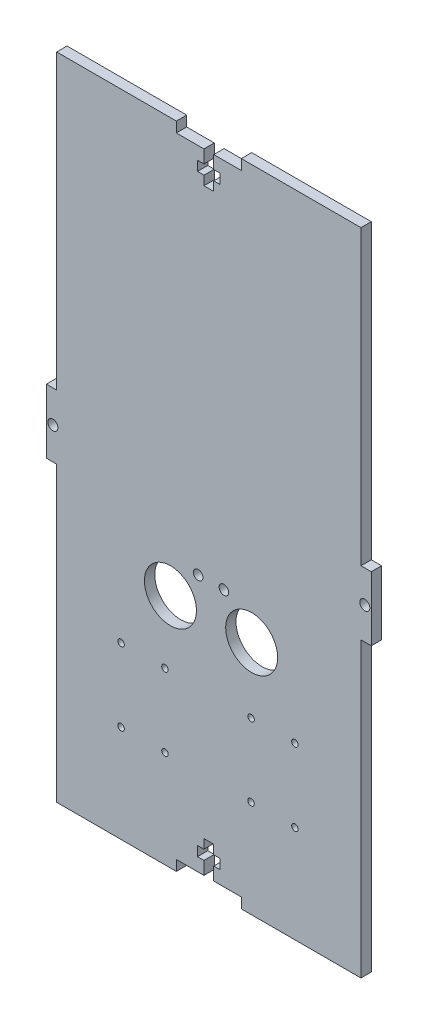
from build123d import *

# Parameters (mm, degrees)
SKETCH1_W           = 100
SKETCH1_H           = 200
BOSS_EXTRUDE2_DEPTH = 3.18
SKETCH2_R           = 1.55
SKETCH2_W           = 3.18
SKETCH2_H           = 90.125
CUT_EXTRUDE1_DEPTH  = 112.84861376
SKETCH4_R           = 1
CUT_EXTRUDE15_DEPTH = 10
SKETCH5_R           = 8
CUT_EXTRUDE16_DEPTH = 112.84861376
SKETCH6_R           = 1.47
CUT_EXTRUDE17_DEPTH = 112.84861376


with BuildPart() as part:
    # Sketch1 → Boss-Extrude2 (new body)
    with BuildSketch(Plane.XY):
        Rectangle(SKETCH1_W, SKETCH1_H)
    extrude(amount=BOSS_EXTRUDE2_DEPTH)

    # Sketch2 → Cut-Extrude1 (cut, through all)
    with BuildSketch(Plane.XY.offset(3.18)):
        with Locations((-48, 0)):
            Circle(SKETCH2_R)
        Polygon((-10, 100), (-10, 96.82), (-1.5, 96.82), (-1.5, 92.82), (-3.5, 92.82), (-3.5, 89.82), (-1.5, 89.82), (-1.5, 87), (1.5, 87), (1.5, 89.82), (3.5, 89.82), (3.5, 92.82), (1.5, 92.82), (1.5, 96.82), (10, 96.82), (10, 100), align=None)
        with Locations((-48.41, 54.9375)):
            Rectangle(SKETCH2_W, SKETCH2_H)
        with Locations((-48.41, -54.9375)):
            Rectangle(SKETCH2_W, SKETCH2_H)
    cut_extrude1 = extrude(amount=-CUT_EXTRUDE1_DEPTH, mode=Mode.SUBTRACT)

    # Mirror1: Cut-Extrude1 across plane
    add(cut_extrude1.mirror(Plane.ZX), mode=Mode.SUBTRACT)

    # Mirror3: Cut-Extrude1 across plane
    add(cut_extrude1.mirror(Plane(origin=(0, 0, 0), x_dir=(0, 0, 1), z_dir=(1, 0, 0))), mode=Mode.SUBTRACT)

    # Sketch4 → Cut-Extrude15 (cut)
    with BuildSketch(Plane(origin=(0, 0, 0), x_dir=(-1, 0, 0), z_dir=(0, 0, -1))):
        with Locations((13.504428345, -70.05)):
            Circle(SKETCH4_R)
        with Locations((27.004428345, -70.05)):
            Circle(SKETCH4_R)
        with Locations((27.004428345, -47.59)):
            Circle(SKETCH4_R)
        with Locations((13.504428345, -47.59)):
            Circle(SKETCH4_R)
        with Locations((-12.995571655, -47.59)):
            Circle(SKETCH4_R)
        with Locations((-26.495571655, -47.59)):
            Circle(SKETCH4_R)
        with Locations((-26.495571655, -70.05)):
            Circle(SKETCH4_R)
        with Locations((-12.995571655, -70.05)):
            Circle(SKETCH4_R)
    extrude(amount=-CUT_EXTRUDE15_DEPTH, mode=Mode.SUBTRACT)

    # Sketch5 → Cut-Extrude16 (cut, through all)
    with BuildSketch(Plane(origin=(0, 0, 0), x_dir=(-1, 0, 0), z_dir=(0, 0, -1))):
        with Locations((11.82, -27.421398987)):
            Circle(SKETCH5_R)
        with Locations((-13.18, -27.421398987)):
            Circle(SKETCH5_R)
    extrude(amount=-CUT_EXTRUDE16_DEPTH, mode=Mode.SUBTRACT)

    # Sketch6 → Cut-Extrude17 (cut, through all)
    with BuildSketch(Plane(origin=(0, 0, 0), x_dir=(-1, 0, 0), z_dir=(0, 0, -1))):
        with Locations((3.283505193, -17.616897143)):
            Circle(SKETCH6_R)
        with Locations((-4.643505193, -17.616897143)):
            Circle(SKETCH6_R)
    extrude(amount=-CUT_EXTRUDE17_DEPTH, mode=Mode.SUBTRACT)


solid = part.part
